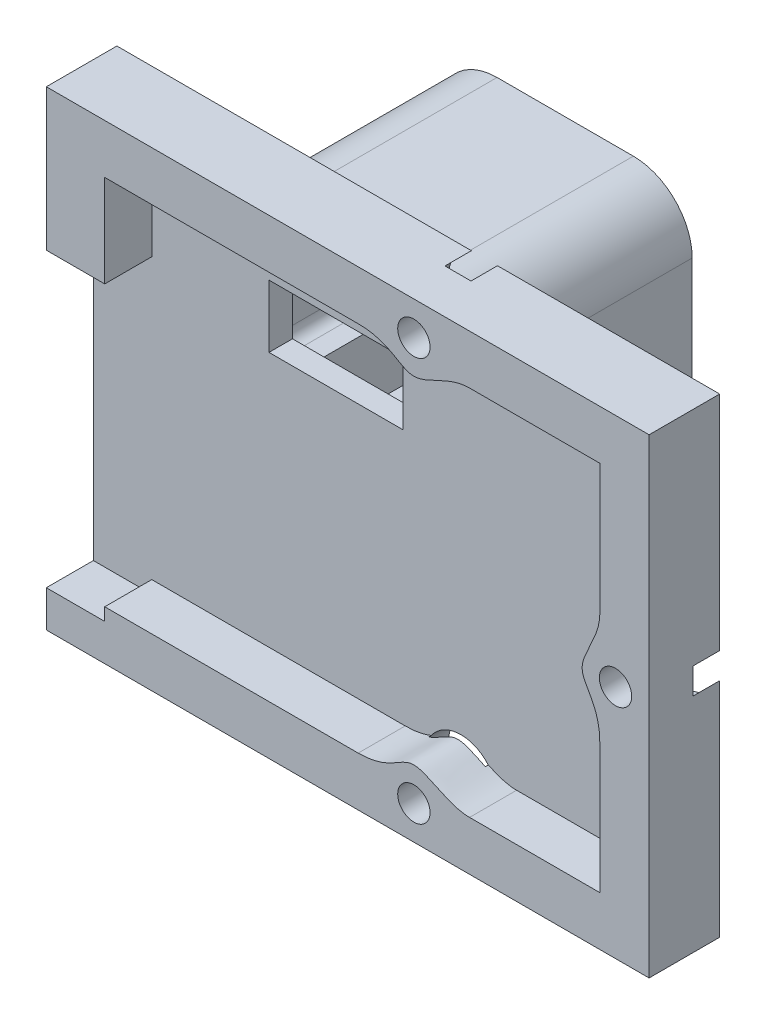
from build123d import *

# Parameters (mm, degrees)
SKETCH11_W          = 20.5
SKETCH11_H          = 16
BOSS_EXTRUDE4_DEPTH = 1.6
SKETCH10_W          = 20.5
SKETCH10_H          = 16
BOSS_EXTRUDE5_DEPTH = 0.8
SKETCH12_R          = 1.225
CUT_EXTRUDE1_DEPTH  = 0.9
SKETCH13_R          = 0.55
CUT_EXTRUDE2_DEPTH  = 1.5
SKETCH14_W          = 4.55
SKETCH14_H          = 2.13
CUT_EXTRUDE3_DEPTH  = 0.8
SKETCH17_W          = 1.985999923
SKETCH17_H          = 9.940122219
CUT_EXTRUDE5_DEPTH  = 1.6
SKETCH18_W          = 8.635
SKETCH18_H          = 7.722
SKETCH18_W_2        = 6.635
SKETCH18_H_2        = 4.222
BOSS_EXTRUDE6_DEPTH = 7
FILLET2_R           = 0.4
FILLET3_R           = 2
SKETCH19_W          = 4.5
SKETCH19_H          = 1.38
CUT_EXTRUDE6_DEPTH  = 7
SKETCH21_W          = 4.5
SKETCH21_H          = 0.8
CUT_EXTRUDE7_DEPTH  = 5.41


with BuildPart() as part:
    # Sketch11 → Boss-Extrude4 (new body)
    with BuildSketch(Plane.XY):
        with Locations((-1.95, 0)):
            Rectangle(SKETCH11_W, SKETCH11_H)
        with BuildLine():
            Line((6.622999053, 6.323000154), (2.19427083, 6.323000154))
            add(Edge.make_bspline(
                [(2.19427083, 6.323000154), (1.446811282, 6.323000154), (0.126304944, 5.123000154), (-0.499421171, 6.323000154), (-1.59427083, 6.323000154)],
                knots=[0, 0, 0, 0, 0.5, 1, 1, 1, 1], degree=3))
            Line((-1.59427083, 6.323000154), (-10.214000077, 6.323000154))
            Line((-10.214000077, 6.323000154), (-10.214000077, -6.323000154))
            Line((-10.214000077, -6.323000154), (-1.59427083, -6.323000154))
            add(Edge.make_bspline(
                [(2.19427083, -6.323000154), (1.446811282, -6.323000154), (0.126304944, -5.123000154), (-0.499421171, -6.323000154), (-1.59427083, -6.323000154)],
                knots=[0, 0, 0, 0, 0.5, 1, 1, 1, 1], degree=3))
            Line((2.19427083, -6.323000154), (6.622999053, -6.323000154))
            Line((6.622999053, -6.323000154), (6.622999053, -1.894271742))
            add(Edge.make_bspline(
                [(6.622999053, 1.894271742), (6.622999053, 1.146811937), (5.422999053, -0.173695015), (6.622999053, -0.799421908), (6.622999053, -1.894271742)],
                knots=[0, 0, 0, 0, 0.5, 1, 1, 1, 1], degree=3))
            Line((6.622999053, 1.894271742), (6.622999053, 6.323000154))
        make_face(mode=Mode.SUBTRACT)
    extrude(amount=BOSS_EXTRUDE4_DEPTH)

    # Sketch10 → Boss-Extrude5 (add)
    with BuildSketch(Plane.XY):
        with Locations((-1.95, 0)):
            Rectangle(SKETCH10_W, SKETCH10_H)
    extrude(amount=-BOSS_EXTRUDE5_DEPTH)

    # Sketch12 → Cut-Extrude1 (cut)
    with BuildSketch(Plane(origin=(0, 0, -0.8), x_dir=(-1, 0, 0), z_dir=(0, 0, -1))):
        with Locations((-0.3, 6.857999949)):
            Circle(SKETCH12_R)
        with Locations((-7.157999783, 0)):
            Circle(SKETCH12_R)
        with Locations((-0.3, -6.857999949)):
            Circle(SKETCH12_R)
    extrude(amount=-CUT_EXTRUDE1_DEPTH, mode=Mode.SUBTRACT)

    # Sketch13 → Cut-Extrude2 (cut)
    with BuildSketch(Plane(origin=(0, 0, 0.1), x_dir=(-1, 0, 0), z_dir=(0, 0, -1))):
        with Locations((-0.3, 6.857999949)):
            Circle(SKETCH13_R)
        with Locations((-7.157999783, 0)):
            Circle(SKETCH13_R)
        with Locations((-0.3, -6.857999949)):
            Circle(SKETCH13_R)
    extrude(amount=-CUT_EXTRUDE2_DEPTH, mode=Mode.SUBTRACT)

    # Sketch14 → Cut-Extrude3 (cut)
    with BuildSketch(Plane(origin=(0, 0, -0.8), x_dir=(-1, 0, 0), z_dir=(0, 0, -1))):
        with Locations((3.953000077, 3.426999846)):
            Rectangle(SKETCH14_W, SKETCH14_H)
    extrude(amount=-CUT_EXTRUDE3_DEPTH, mode=Mode.SUBTRACT)

    # Sketch17 → Cut-Extrude5 (cut)
    with BuildSketch(Plane.XY.offset(1.6)):
        with Locations((-11.207000039, -1.784681503)):
            Rectangle(SKETCH17_W, SKETCH17_H)
    extrude(amount=-CUT_EXTRUDE5_DEPTH, mode=Mode.SUBTRACT)

    # Sketch18 → Boss-Extrude6 (add)
    with BuildSketch(Plane(origin=(0, 0, -0.8), x_dir=(-1, 0, 0), z_dir=(0, 0, -1))):
        with Locations((3.953000077, 2.676999846)):
            Rectangle(SKETCH18_W, SKETCH18_H)
        with Locations((3.953000077, 3.426999846)):
            Rectangle(SKETCH18_W_2, SKETCH18_H_2, mode=Mode.SUBTRACT)
    extrude(amount=BOSS_EXTRUDE6_DEPTH)

    # Fillet2
    fillet2_edges = [part.edges().sort_by_distance(p)[0] for p in [
        (-0.635500077, 5.537999846, -4.3),
        (-0.635500077, 1.315999846, -4.3),
        (-7.270500077, 1.315999846, -4.3),
        (-7.270500077, 5.537999846, -4.3),
    ]]
    fillet(fillet2_edges, radius=FILLET2_R)

    # Fillet3
    # the kernel refuses this fillet: 2 mm, written as the material it takes off along each edge
    with BuildSketch(Plane(origin=(-8.270500077, 6.537999846, -0.8), x_dir=(0, -1, 0), z_dir=(0, 0, -1)), Plane(origin=(0.364499923, -1.184000154, -0.8), x_dir=(0, 1, 0), z_dir=(0, 0, -1)), Plane(origin=(-8.270500077, -1.184000154, -0.8), x_dir=(1, 0, 0), z_dir=(0, 0, -1))) as fillet3_piece_1:
        with BuildLine():
            CenterArc((FILLET3_R, -FILLET3_R), FILLET3_R, 90, 90)
            Line((0, -FILLET3_R), (0, 0))
            Line((0, 0), (FILLET3_R, 0))
        make_face()
    extrude(amount=12, mode=Mode.SUBTRACT)
    with BuildSketch(Plane(origin=(0.364499923, 6.537999846, -0.8), x_dir=(0, -1, 0), z_dir=(0, 0, -1))) as fillet3_piece_2:
        with BuildLine():
            CenterArc((FILLET3_R, FILLET3_R), FILLET3_R, 180, 90)
            Line((0, FILLET3_R), (0, 0))
            Line((0, 0), (FILLET3_R, 0))
        make_face()
    extrude(amount=12, mode=Mode.SUBTRACT)

    # Sketch19 → Cut-Extrude6 (cut)
    with BuildSketch(Plane(origin=(0, 0, -7.8), x_dir=(-1, 0, 0), z_dir=(0, 0, -1))):
        with Locations((3.953000077, 0.625999846)):
            Rectangle(SKETCH19_W, SKETCH19_H)
    extrude(amount=-CUT_EXTRUDE6_DEPTH, mode=Mode.SUBTRACT)

    # Sketch21 → Cut-Extrude7 (cut)
    with BuildSketch(Plane(origin=(0, 0, -6.21), x_dir=(-1, 0, 0), z_dir=(0, 0, -1))):
        with Locations((3.953000077, -0.464000154)):
            Rectangle(SKETCH21_W, SKETCH21_H)
    extrude(amount=-CUT_EXTRUDE7_DEPTH, mode=Mode.SUBTRACT)


solid = part.part
